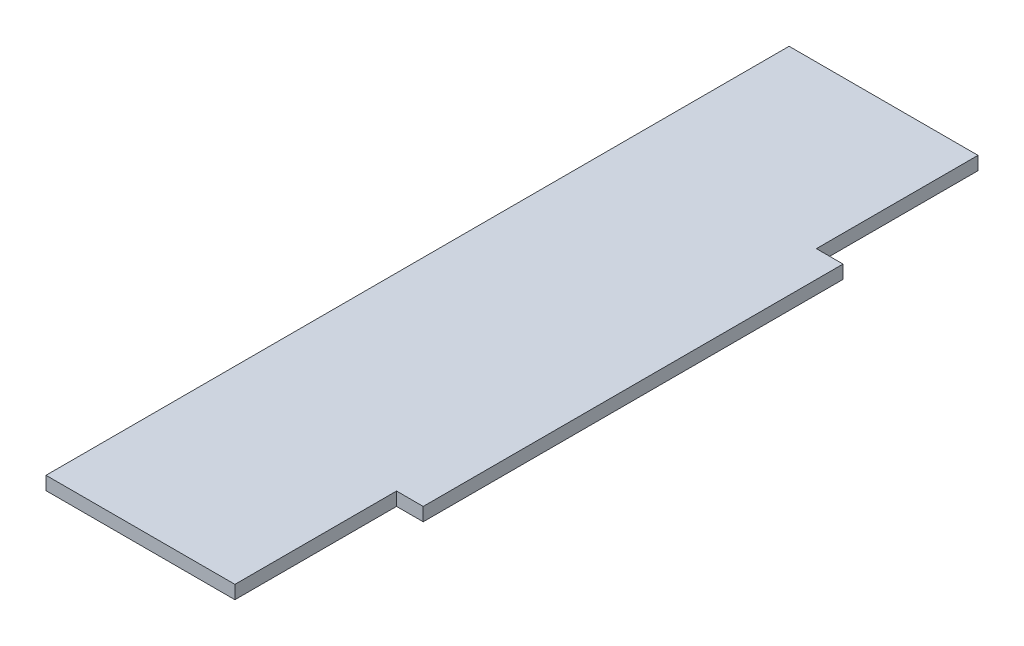
from build123d import *

# Parameters (mm, degrees)
BOSS_EXTRUDE1_DEPTH = 3.175


with BuildPart() as part:
    # Sketch1 → Boss-Extrude1 (new body)
    with BuildSketch(Plane(origin=(0, 0, 0), x_dir=(1, 0, 0), z_dir=(0, 1, 0))):
        Polygon((22.5, 38.5), (-22.5, 38.5), (-22.5, 0), (-22.5, -100), (-22.5, -138.5), (22.5, -138.5), (22.5, -100), (28.85, -100), (28.85, 0), (22.5, 0), align=None)
    extrude(amount=BOSS_EXTRUDE1_DEPTH)


solid = part.part
